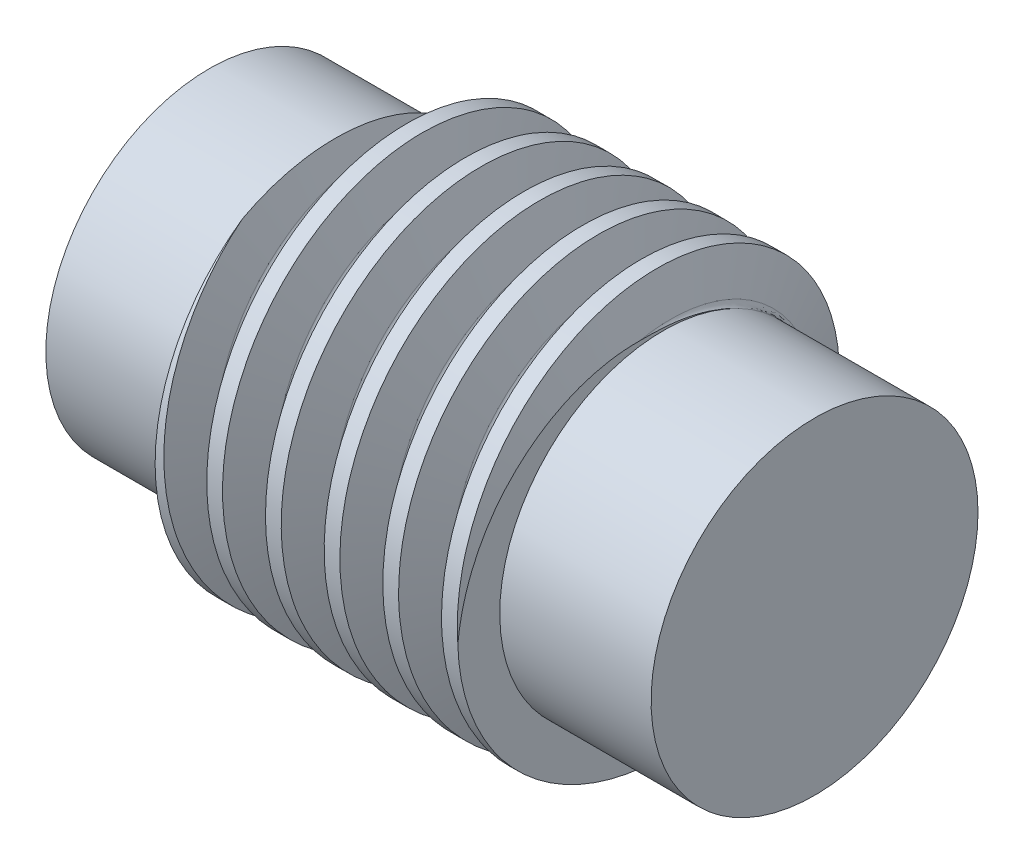
from build123d import *

# Parameters (mm, degrees)
SKETCH_1_W      = 16.2
SKETCH_1_H      = 11
SWEEP_1_PITCH   = 3.141592654
SKETCH_4_R      = 8.75
EXTRUDE_1_DEPTH = 8.1
EXTRUDE_START   = 8.1
SKETCH_5_R      = 8.75
EXTRUDE_2_DEPTH = 8.1


with BuildPart() as part:
    # 草图1 → 旋转1 (revolve)
    with BuildSketch(Plane.XY, mode=Mode.PRIVATE) as revolve_1_sk:
        with Locations((8.1, 5.5)):
            Rectangle(SKETCH_1_W, SKETCH_1_H)
    revolve(revolve_1_sk.sketch.rotate(Axis((-56.849408284, 0, 0), (1, 0, 0)), 90), axis=Axis((-56.849408284, 0, 0), (1, 0, 0)))

    # 切除-扫描1: the profile of 草图3 profile screwed along a right-hand helix of 10.31324 turns, 10 arcs to a turn; built about Z, then put on its axis
    sweep_1_z = Axis((0, 0, 0), (0, 0, 1))
    sweep_1_corners = [(11.0003, 0, -3.448214384), (11.0003, 0, -1.149259207), (9.000032346, 0, -1.877297093), (8.75, 0, -2.234380289), (8.75, 0, -2.363093301), (9.000032346, 0, -2.720176497)]
    with BuildLine(mode=Mode.PRIVATE) as sweep_1_profile:
        Line(sweep_1_corners[0], sweep_1_corners[1])
        Line(sweep_1_corners[1], sweep_1_corners[2])
        Line(sweep_1_corners[3], sweep_1_corners[4])
        Line(sweep_1_corners[5], sweep_1_corners[0])
        ThreePointArc((9.000032346, 0, -1.877297093), (8.818722223, 0, -2.016421243), (8.75, 0, -2.234380289))
        ThreePointArc((8.75, 0, -2.363093301), (8.818722223, 0, -2.581052347), (9.000032346, 0, -2.720176497))
    sweep_1_cap = Face(sweep_1_profile.wire())
    sweep_1_arcs = [((9.000032346, 0, -1.877297093), (8.75, 0, -1.968301425), (8.75, 0, -2.234380289), (1, 0.8191520442889829, 1)), ((8.75, 0, -2.363093301), (8.75, 0, -2.629172166), (9.000032346, 0, -2.720176497), (1, 0.8191520442889978, 1))]  # start, shoulder, end, weights
    sweep_1_turn_angles = [0, 18, 36, 54, 72, 90, 108, 126, 144, 162, 180, 198, 216, 234, 252, 270, 288, 306, 324, 342, 360]
    sweep_1_turn_weights = [1, 0.9510565162951535, 1, 0.9510565162951535, 1, 0.9510565162951535, 1, 0.9510565162951535, 1, 0.9510565162951535, 1, 0.9510565162951535, 1, 0.9510565162951535, 1, 0.9510565162951535, 1, 0.9510565162951535, 1, 0.9510565162951535, 1]
    sweep_1_turn_rails = [Edge.make_bspline([Vector(p[0], p[1], 0).rotate(sweep_1_z, sweep_1_turn_angles[k]) / sweep_1_turn_weights[k] + Vector(0, 0, p[2] + SWEEP_1_PITCH * sweep_1_turn_angles[k] / 360) for k in range(21)], [0, 0, 0, 1, 1, 2, 2, 3, 3, 4, 4, 5, 5, 6, 6, 7, 7, 8, 8, 9, 9, 10, 10, 10], 2, sweep_1_turn_weights) for p in sweep_1_corners]
    sweep_1_turn_sides = [*[Face.make_surface_from_curves(sweep_1_turn_rails[p[0]], sweep_1_turn_rails[p[1]]) for p in [(0, 1), (1, 2), (3, 4), (5, 0)]], *[Face.make_bezier_surface([[Vector(p[j][0], p[j][1], 0).rotate(sweep_1_z, sweep_1_turn_angles[2 * i + k]) / sweep_1_turn_weights[2 * i + k] + Vector(0, 0, p[j][2] + SWEEP_1_PITCH * sweep_1_turn_angles[2 * i + k] / 360) for k in range(3)] for j in range(3)], [[p[3][j] * sweep_1_turn_weights[2 * i + k] for k in range(3)] for j in range(3)]) for p in sweep_1_arcs for i in range(10)]]
    sweep_1_last_angles = [3600, 3618, 3636, 3654, 3672, 3690, 3708, 3710.383256224, 3712.766512448]
    sweep_1_last_weights = [1, 0.9510565162951535, 1, 0.9510565162951535, 1, 0.9510565162951535, 1, 0.999135024926525, 1]
    sweep_1_last_rails = [Edge.make_bspline([Vector(p[0], p[1], 0).rotate(sweep_1_z, sweep_1_last_angles[k]) / sweep_1_last_weights[k] + Vector(0, 0, p[2] + SWEEP_1_PITCH * sweep_1_last_angles[k] / 360) for k in range(9)], [0, 0, 0, 1, 1, 2, 2, 3, 3, 4, 4, 4], 2, sweep_1_last_weights) for p in sweep_1_corners]
    sweep_1_last_sides = [*[Face.make_surface_from_curves(sweep_1_last_rails[p[0]], sweep_1_last_rails[p[1]]) for p in [(0, 1), (1, 2), (3, 4), (5, 0)]], *[Face.make_bezier_surface([[Vector(p[j][0], p[j][1], 0).rotate(sweep_1_z, sweep_1_last_angles[2 * i + k]) / sweep_1_last_weights[2 * i + k] + Vector(0, 0, p[j][2] + SWEEP_1_PITCH * sweep_1_last_angles[2 * i + k] / 360) for k in range(3)] for j in range(3)], [[p[3][j] * sweep_1_last_weights[2 * i + k] for k in range(3)] for j in range(3)]) for p in sweep_1_arcs for i in range(4)]]
    sweep_1 = Plane(origin=(0, 0, 0), x_dir=(0, 1, 0), z_dir=(1, 0, 0)) * Solid(Shell([*[p.moved(Location((0, 0, SWEEP_1_PITCH * i))) for i in range(10) for p in sweep_1_turn_sides], *sweep_1_last_sides, sweep_1_cap, sweep_1_cap.rotate(sweep_1_z, 3712.766512448).moved(Location((0, 0, SWEEP_1_PITCH * 3712.766512448 / 360)))]))
    add(sweep_1, mode=Mode.SUBTRACT)

    # 草图4 → 凸台-拉伸1 (add)
    with BuildSketch(Plane(origin=(0, 0, 0), x_dir=(0, 0, -1), z_dir=(1, 0, 0))):
        Circle(SKETCH_4_R)
    extrude(amount=-EXTRUDE_1_DEPTH)

    # 草图5 → 凸台-拉伸2 (add)
    with BuildSketch(Plane(origin=(16.2, 0, 0), x_dir=(0, 0, -1), z_dir=(1, 0, 0)).offset(EXTRUDE_START)):
        Circle(SKETCH_5_R)
    extrude(amount=-EXTRUDE_2_DEPTH)


solid = part.part
